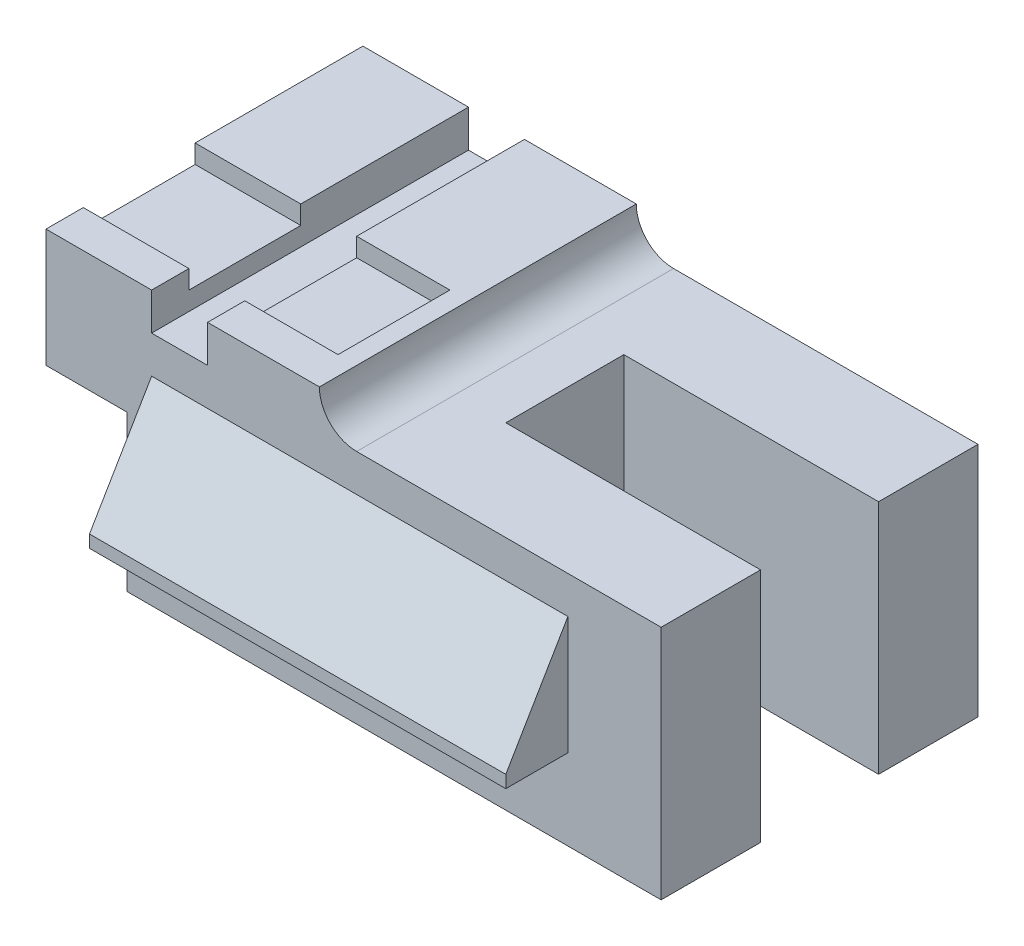
from build123d import *

# Parameters (mm, degrees)
SCHIZZO1_W                   = 99
SCHIZZO1_H                   = 51
ESTRUSIONE_ESTRUSIONE1_DEPTH = 44
SCHIZZO2_W                   = 55
SCHIZZO2_H                   = 51
TAGLIO_ESTRUSIONE1_DEPTH     = 6
SCHIZZO3_W                   = 41
SCHIZZO3_H                   = 18
TAGLIO_ESTRUSIONE2_DEPTH     = 3
SCHIZZO4_W                   = 9
SCHIZZO4_H                   = 51
TAGLIO_ESTRUSIONE3_DEPTH     = 6
SCHIZZO5_W                   = 41
SCHIZZO5_H                   = 19
TAGLIO_ESTRUSIONE4_DEPTH     = 118.669027361
SCHIZZO6_W                   = 13
SCHIZZO6_H                   = 25
TAGLIO_ESTRUSIONE5_DEPTH     = 120.741387999
SCHIZZO7_W                   = 67
SCHIZZO7_H                   = 19
ESTRUSIONE_ESTRUSIONE2_DEPTH = 10
TAGLIO_ESTRUSIONE6_DEPTH     = 108.670794555
RACCORDO1_R                  = 6


with BuildPart() as part:
    # Schizzo1 → Estrusione-Estrusione1 (new body)
    with BuildSketch(Plane(origin=(0, 0, 0), x_dir=(1, 0, 0), z_dir=(0, 1, 0))):
        with Locations((-49.5, 25.5)):
            Rectangle(SCHIZZO1_W, SCHIZZO1_H)
    extrude(amount=ESTRUSIONE_ESTRUSIONE1_DEPTH)

    # Schizzo2 → Taglio-Estrusione1 (cut)
    with BuildSketch(Plane(origin=(0, 44, 0), x_dir=(1, 0, 0), z_dir=(0, 1, 0))):
        with Locations((-27.5, 25.5)):
            Rectangle(SCHIZZO2_W, SCHIZZO2_H)
    extrude(amount=-TAGLIO_ESTRUSIONE1_DEPTH, mode=Mode.SUBTRACT)

    # Schizzo3 → Taglio-Estrusione2 (cut)
    with BuildSketch(Plane(origin=(0, 44, 0), x_dir=(1, 0, 0), z_dir=(0, 1, 0))):
        with Locations((-78.5, 15)):
            Rectangle(SCHIZZO3_W, SCHIZZO3_H)
    extrude(amount=-TAGLIO_ESTRUSIONE2_DEPTH, mode=Mode.SUBTRACT)

    # Schizzo4 → Taglio-Estrusione3 (cut)
    with BuildSketch(Plane(origin=(0, 44, 0), x_dir=(1, 0, 0), z_dir=(0, 1, 0))):
        with Locations((-77.5, 25.5)):
            Rectangle(SCHIZZO4_W, SCHIZZO4_H)
    extrude(amount=-TAGLIO_ESTRUSIONE3_DEPTH, mode=Mode.SUBTRACT)

    # Schizzo5 → Taglio-Estrusione4 (cut, through all)
    with BuildSketch(Plane(origin=(0, 38, 0), x_dir=(1, 0, 0), z_dir=(0, 1, 0))):
        with Locations((-20.5, 25.5)):
            Rectangle(SCHIZZO5_W, SCHIZZO5_H)
    extrude(amount=-TAGLIO_ESTRUSIONE4_DEPTH, mode=Mode.SUBTRACT)

    # Schizzo6 → Taglio-Estrusione5 (cut, through all)
    with BuildSketch(Plane.XY):
        with Locations((-92.5, 12.5)):
            Rectangle(SCHIZZO6_W, SCHIZZO6_H)
    extrude(amount=-TAGLIO_ESTRUSIONE5_DEPTH, mode=Mode.SUBTRACT)

    # Schizzo7 → Estrusione-Estrusione2 (add)
    with BuildSketch(Plane.XY):
        with Locations((-48.5, 22.5)):
            Rectangle(SCHIZZO7_W, SCHIZZO7_H)
    extrude(amount=ESTRUSIONE_ESTRUSIONE2_DEPTH)

    # Schizzo8 → Taglio-Estrusione6 (cut, through all)
    with BuildSketch(Plane(origin=(-15, 0, 0), x_dir=(0, 0, -1), z_dir=(1, 0, 0))):
        Polygon((0, 32), (-10, 15), (-10, 32), align=None)
    extrude(amount=-TAGLIO_ESTRUSIONE6_DEPTH, mode=Mode.SUBTRACT)

    # Raccordo1
    raccordo1_edges = [part.edges().sort_by_distance(p)[0] for p in [
        (-55, 38, -25.5),
    ]]
    fillet(raccordo1_edges, radius=RACCORDO1_R - 0.0001)  # a hair under: the kernel refuses the full size


solid = part.part
